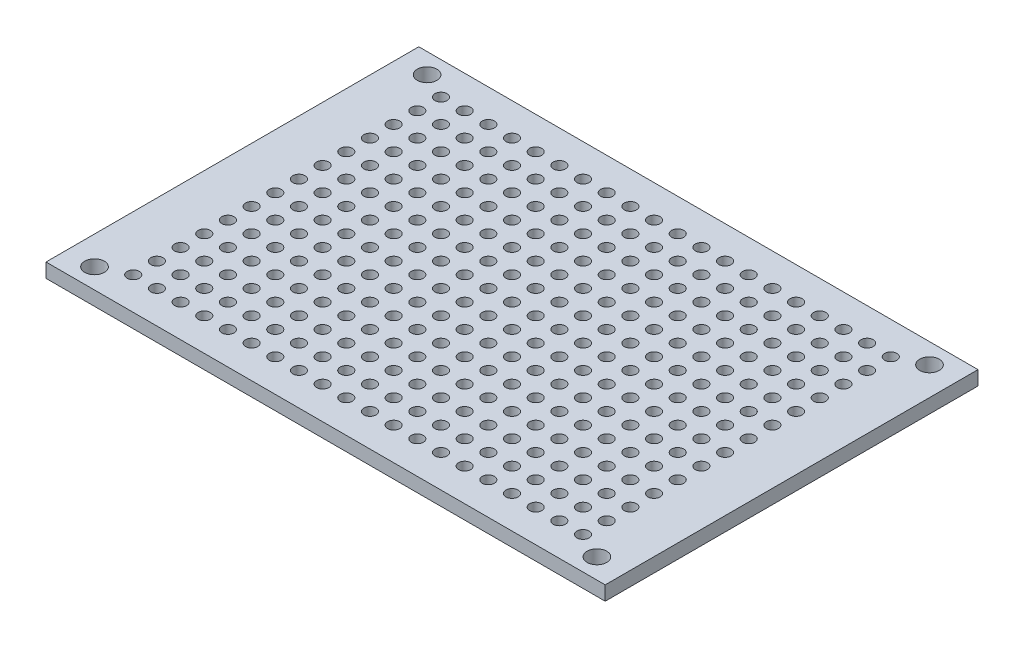
from build123d import *

# Parameters (mm, degrees)
SKETCH1_W                          = 60
SKETCH1_H                          = 40
BOSS_EXTRUDE1_DEPTH                = 0.762
F_1_3_START                        = -0.762
F_1_3_1_3_DIAMETER_HOLE1_OUTLINE_R = 0.65
F_1_3_1_3_DIAMETER_HOLE1_DEPTH     = 1.524
F_2_1_2_1_DIAMETER_HOLE1_D         = 2.1


# Read off the part's stored shape, not the designer's step: Ø1.3 (1.3) Diameter Hole1
with BuildPart() as part:
    # Sketch1 → Boss-Extrude1 (new, symmetric)
    with BuildSketch(Plane(origin=(0, 0, 0), x_dir=(1, 0, 0), z_dir=(0, 1, 0))):
        with Locations((30, 20)):
            Rectangle(SKETCH1_W, SKETCH1_H)
    extrude(amount=BOSS_EXTRUDE1_DEPTH, both=True)

    # Ø1.3 (1.3) Diameter Hole1 outline → Ø1.3 (1.3) Diameter Hole1 (cut)
    with BuildSketch(Plane(origin=(0, 0, 0), x_dir=(1, 0, 0), z_dir=(0, 1, 0)).offset(F_1_3_START)):
        with Locations((5.87, 36.51)):
            Circle(F_1_3_1_3_DIAMETER_HOLE1_OUTLINE_R)
        with Locations((5.87, 33.97)):
            Circle(F_1_3_1_3_DIAMETER_HOLE1_OUTLINE_R)
        with Locations((5.87, 31.43)):
            Circle(F_1_3_1_3_DIAMETER_HOLE1_OUTLINE_R)
        with Locations((5.87, 28.89)):
            Circle(F_1_3_1_3_DIAMETER_HOLE1_OUTLINE_R)
        with Locations((5.87, 26.35)):
            Circle(F_1_3_1_3_DIAMETER_HOLE1_OUTLINE_R)
        with Locations((5.87, 23.81)):
            Circle(F_1_3_1_3_DIAMETER_HOLE1_OUTLINE_R)
        with Locations((5.87, 21.27)):
            Circle(F_1_3_1_3_DIAMETER_HOLE1_OUTLINE_R)
        with Locations((5.87, 18.73)):
            Circle(F_1_3_1_3_DIAMETER_HOLE1_OUTLINE_R)
        with Locations((5.87, 16.19)):
            Circle(F_1_3_1_3_DIAMETER_HOLE1_OUTLINE_R)
        with Locations((5.87, 13.65)):
            Circle(F_1_3_1_3_DIAMETER_HOLE1_OUTLINE_R)
        with Locations((5.87, 11.11)):
            Circle(F_1_3_1_3_DIAMETER_HOLE1_OUTLINE_R)
        with Locations((5.87, 8.57)):
            Circle(F_1_3_1_3_DIAMETER_HOLE1_OUTLINE_R)
        with Locations((5.87, 6.03)):
            Circle(F_1_3_1_3_DIAMETER_HOLE1_OUTLINE_R)
        with Locations((54.13, 36.51)):
            Circle(F_1_3_1_3_DIAMETER_HOLE1_OUTLINE_R)
        with Locations((51.59, 36.51)):
            Circle(F_1_3_1_3_DIAMETER_HOLE1_OUTLINE_R)
        with Locations((49.05, 36.51)):
            Circle(F_1_3_1_3_DIAMETER_HOLE1_OUTLINE_R)
        with Locations((46.51, 36.51)):
            Circle(F_1_3_1_3_DIAMETER_HOLE1_OUTLINE_R)
        with Locations((43.97, 36.51)):
            Circle(F_1_3_1_3_DIAMETER_HOLE1_OUTLINE_R)
        with Locations((41.43, 36.51)):
            Circle(F_1_3_1_3_DIAMETER_HOLE1_OUTLINE_R)
        with Locations((38.89, 36.51)):
            Circle(F_1_3_1_3_DIAMETER_HOLE1_OUTLINE_R)
        with Locations((36.35, 36.51)):
            Circle(F_1_3_1_3_DIAMETER_HOLE1_OUTLINE_R)
        with Locations((33.81, 36.51)):
            Circle(F_1_3_1_3_DIAMETER_HOLE1_OUTLINE_R)
        with Locations((31.27, 36.51)):
            Circle(F_1_3_1_3_DIAMETER_HOLE1_OUTLINE_R)
        with Locations((28.73, 36.51)):
            Circle(F_1_3_1_3_DIAMETER_HOLE1_OUTLINE_R)
        with Locations((26.19, 36.51)):
            Circle(F_1_3_1_3_DIAMETER_HOLE1_OUTLINE_R)
        with Locations((23.65, 36.51)):
            Circle(F_1_3_1_3_DIAMETER_HOLE1_OUTLINE_R)
        with Locations((21.11, 36.51)):
            Circle(F_1_3_1_3_DIAMETER_HOLE1_OUTLINE_R)
        with Locations((18.57, 36.51)):
            Circle(F_1_3_1_3_DIAMETER_HOLE1_OUTLINE_R)
        with Locations((16.03, 36.51)):
            Circle(F_1_3_1_3_DIAMETER_HOLE1_OUTLINE_R)
        with Locations((13.49, 36.51)):
            Circle(F_1_3_1_3_DIAMETER_HOLE1_OUTLINE_R)
        with Locations((10.95, 36.51)):
            Circle(F_1_3_1_3_DIAMETER_HOLE1_OUTLINE_R)
        with Locations((8.41, 36.51)):
            Circle(F_1_3_1_3_DIAMETER_HOLE1_OUTLINE_R)
        with Locations((54.13, 33.97)):
            Circle(F_1_3_1_3_DIAMETER_HOLE1_OUTLINE_R)
        with Locations((51.59, 33.97)):
            Circle(F_1_3_1_3_DIAMETER_HOLE1_OUTLINE_R)
        with Locations((49.05, 33.97)):
            Circle(F_1_3_1_3_DIAMETER_HOLE1_OUTLINE_R)
        with Locations((46.51, 33.97)):
            Circle(F_1_3_1_3_DIAMETER_HOLE1_OUTLINE_R)
        with Locations((43.97, 33.97)):
            Circle(F_1_3_1_3_DIAMETER_HOLE1_OUTLINE_R)
        with Locations((41.43, 33.97)):
            Circle(F_1_3_1_3_DIAMETER_HOLE1_OUTLINE_R)
        with Locations((38.89, 33.97)):
            Circle(F_1_3_1_3_DIAMETER_HOLE1_OUTLINE_R)
        with Locations((36.35, 33.97)):
            Circle(F_1_3_1_3_DIAMETER_HOLE1_OUTLINE_R)
        with Locations((33.81, 33.97)):
            Circle(F_1_3_1_3_DIAMETER_HOLE1_OUTLINE_R)
        with Locations((31.27, 33.97)):
            Circle(F_1_3_1_3_DIAMETER_HOLE1_OUTLINE_R)
        with Locations((28.73, 33.97)):
            Circle(F_1_3_1_3_DIAMETER_HOLE1_OUTLINE_R)
        with Locations((26.19, 33.97)):
            Circle(F_1_3_1_3_DIAMETER_HOLE1_OUTLINE_R)
        with Locations((23.65, 33.97)):
            Circle(F_1_3_1_3_DIAMETER_HOLE1_OUTLINE_R)
        with Locations((21.11, 33.97)):
            Circle(F_1_3_1_3_DIAMETER_HOLE1_OUTLINE_R)
        with Locations((18.57, 33.97)):
            Circle(F_1_3_1_3_DIAMETER_HOLE1_OUTLINE_R)
        with Locations((16.03, 33.97)):
            Circle(F_1_3_1_3_DIAMETER_HOLE1_OUTLINE_R)
        with Locations((13.49, 33.97)):
            Circle(F_1_3_1_3_DIAMETER_HOLE1_OUTLINE_R)
        with Locations((10.95, 33.97)):
            Circle(F_1_3_1_3_DIAMETER_HOLE1_OUTLINE_R)
        with Locations((8.41, 33.97)):
            Circle(F_1_3_1_3_DIAMETER_HOLE1_OUTLINE_R)
        with Locations((54.13, 31.43)):
            Circle(F_1_3_1_3_DIAMETER_HOLE1_OUTLINE_R)
        with Locations((51.59, 31.43)):
            Circle(F_1_3_1_3_DIAMETER_HOLE1_OUTLINE_R)
        with Locations((49.05, 31.43)):
            Circle(F_1_3_1_3_DIAMETER_HOLE1_OUTLINE_R)
        with Locations((46.51, 31.43)):
            Circle(F_1_3_1_3_DIAMETER_HOLE1_OUTLINE_R)
        with Locations((43.97, 31.43)):
            Circle(F_1_3_1_3_DIAMETER_HOLE1_OUTLINE_R)
        with Locations((41.43, 31.43)):
            Circle(F_1_3_1_3_DIAMETER_HOLE1_OUTLINE_R)
        with Locations((38.89, 31.43)):
            Circle(F_1_3_1_3_DIAMETER_HOLE1_OUTLINE_R)
        with Locations((36.35, 31.43)):
            Circle(F_1_3_1_3_DIAMETER_HOLE1_OUTLINE_R)
        with Locations((33.81, 31.43)):
            Circle(F_1_3_1_3_DIAMETER_HOLE1_OUTLINE_R)
        with Locations((31.27, 31.43)):
            Circle(F_1_3_1_3_DIAMETER_HOLE1_OUTLINE_R)
        with Locations((28.73, 31.43)):
            Circle(F_1_3_1_3_DIAMETER_HOLE1_OUTLINE_R)
        with Locations((26.19, 31.43)):
            Circle(F_1_3_1_3_DIAMETER_HOLE1_OUTLINE_R)
        with Locations((23.65, 31.43)):
            Circle(F_1_3_1_3_DIAMETER_HOLE1_OUTLINE_R)
        with Locations((21.11, 31.43)):
            Circle(F_1_3_1_3_DIAMETER_HOLE1_OUTLINE_R)
        with Locations((18.57, 31.43)):
            Circle(F_1_3_1_3_DIAMETER_HOLE1_OUTLINE_R)
        with Locations((16.03, 31.43)):
            Circle(F_1_3_1_3_DIAMETER_HOLE1_OUTLINE_R)
        with Locations((13.49, 31.43)):
            Circle(F_1_3_1_3_DIAMETER_HOLE1_OUTLINE_R)
        with Locations((10.95, 31.43)):
            Circle(F_1_3_1_3_DIAMETER_HOLE1_OUTLINE_R)
        with Locations((8.41, 31.43)):
            Circle(F_1_3_1_3_DIAMETER_HOLE1_OUTLINE_R)
        with Locations((54.13, 28.89)):
            Circle(F_1_3_1_3_DIAMETER_HOLE1_OUTLINE_R)
        with Locations((51.59, 28.89)):
            Circle(F_1_3_1_3_DIAMETER_HOLE1_OUTLINE_R)
        with Locations((49.05, 28.89)):
            Circle(F_1_3_1_3_DIAMETER_HOLE1_OUTLINE_R)
        with Locations((46.51, 28.89)):
            Circle(F_1_3_1_3_DIAMETER_HOLE1_OUTLINE_R)
        with Locations((43.97, 28.89)):
            Circle(F_1_3_1_3_DIAMETER_HOLE1_OUTLINE_R)
        with Locations((41.43, 28.89)):
            Circle(F_1_3_1_3_DIAMETER_HOLE1_OUTLINE_R)
        with Locations((38.89, 28.89)):
            Circle(F_1_3_1_3_DIAMETER_HOLE1_OUTLINE_R)
        with Locations((36.35, 28.89)):
            Circle(F_1_3_1_3_DIAMETER_HOLE1_OUTLINE_R)
        with Locations((33.81, 28.89)):
            Circle(F_1_3_1_3_DIAMETER_HOLE1_OUTLINE_R)
        with Locations((31.27, 28.89)):
            Circle(F_1_3_1_3_DIAMETER_HOLE1_OUTLINE_R)
        with Locations((28.73, 28.89)):
            Circle(F_1_3_1_3_DIAMETER_HOLE1_OUTLINE_R)
        with Locations((26.19, 28.89)):
            Circle(F_1_3_1_3_DIAMETER_HOLE1_OUTLINE_R)
        with Locations((23.65, 28.89)):
            Circle(F_1_3_1_3_DIAMETER_HOLE1_OUTLINE_R)
        with Locations((21.11, 28.89)):
            Circle(F_1_3_1_3_DIAMETER_HOLE1_OUTLINE_R)
        with Locations((18.57, 28.89)):
            Circle(F_1_3_1_3_DIAMETER_HOLE1_OUTLINE_R)
        with Locations((16.03, 28.89)):
            Circle(F_1_3_1_3_DIAMETER_HOLE1_OUTLINE_R)
        with Locations((13.49, 28.89)):
            Circle(F_1_3_1_3_DIAMETER_HOLE1_OUTLINE_R)
        with Locations((10.95, 28.89)):
            Circle(F_1_3_1_3_DIAMETER_HOLE1_OUTLINE_R)
        with Locations((8.41, 28.89)):
            Circle(F_1_3_1_3_DIAMETER_HOLE1_OUTLINE_R)
        with Locations((54.13, 26.35)):
            Circle(F_1_3_1_3_DIAMETER_HOLE1_OUTLINE_R)
        with Locations((51.59, 26.35)):
            Circle(F_1_3_1_3_DIAMETER_HOLE1_OUTLINE_R)
        with Locations((49.05, 26.35)):
            Circle(F_1_3_1_3_DIAMETER_HOLE1_OUTLINE_R)
        with Locations((46.51, 26.35)):
            Circle(F_1_3_1_3_DIAMETER_HOLE1_OUTLINE_R)
        with Locations((43.97, 26.35)):
            Circle(F_1_3_1_3_DIAMETER_HOLE1_OUTLINE_R)
        with Locations((41.43, 26.35)):
            Circle(F_1_3_1_3_DIAMETER_HOLE1_OUTLINE_R)
        with Locations((38.89, 26.35)):
            Circle(F_1_3_1_3_DIAMETER_HOLE1_OUTLINE_R)
        with Locations((36.35, 26.35)):
            Circle(F_1_3_1_3_DIAMETER_HOLE1_OUTLINE_R)
        with Locations((33.81, 26.35)):
            Circle(F_1_3_1_3_DIAMETER_HOLE1_OUTLINE_R)
        with Locations((31.27, 26.35)):
            Circle(F_1_3_1_3_DIAMETER_HOLE1_OUTLINE_R)
        with Locations((28.73, 26.35)):
            Circle(F_1_3_1_3_DIAMETER_HOLE1_OUTLINE_R)
        with Locations((26.19, 26.35)):
            Circle(F_1_3_1_3_DIAMETER_HOLE1_OUTLINE_R)
        with Locations((23.65, 26.35)):
            Circle(F_1_3_1_3_DIAMETER_HOLE1_OUTLINE_R)
        with Locations((21.11, 26.35)):
            Circle(F_1_3_1_3_DIAMETER_HOLE1_OUTLINE_R)
        with Locations((18.57, 26.35)):
            Circle(F_1_3_1_3_DIAMETER_HOLE1_OUTLINE_R)
        with Locations((16.03, 26.35)):
            Circle(F_1_3_1_3_DIAMETER_HOLE1_OUTLINE_R)
        with Locations((13.49, 26.35)):
            Circle(F_1_3_1_3_DIAMETER_HOLE1_OUTLINE_R)
        with Locations((10.95, 26.35)):
            Circle(F_1_3_1_3_DIAMETER_HOLE1_OUTLINE_R)
        with Locations((8.41, 26.35)):
            Circle(F_1_3_1_3_DIAMETER_HOLE1_OUTLINE_R)
        with Locations((54.13, 23.81)):
            Circle(F_1_3_1_3_DIAMETER_HOLE1_OUTLINE_R)
        with Locations((51.59, 23.81)):
            Circle(F_1_3_1_3_DIAMETER_HOLE1_OUTLINE_R)
        with Locations((49.05, 23.81)):
            Circle(F_1_3_1_3_DIAMETER_HOLE1_OUTLINE_R)
        with Locations((46.51, 23.81)):
            Circle(F_1_3_1_3_DIAMETER_HOLE1_OUTLINE_R)
        with Locations((43.97, 23.81)):
            Circle(F_1_3_1_3_DIAMETER_HOLE1_OUTLINE_R)
        with Locations((41.43, 23.81)):
            Circle(F_1_3_1_3_DIAMETER_HOLE1_OUTLINE_R)
        with Locations((38.89, 23.81)):
            Circle(F_1_3_1_3_DIAMETER_HOLE1_OUTLINE_R)
        with Locations((36.35, 23.81)):
            Circle(F_1_3_1_3_DIAMETER_HOLE1_OUTLINE_R)
        with Locations((33.81, 23.81)):
            Circle(F_1_3_1_3_DIAMETER_HOLE1_OUTLINE_R)
        with Locations((31.27, 23.81)):
            Circle(F_1_3_1_3_DIAMETER_HOLE1_OUTLINE_R)
        with Locations((28.73, 23.81)):
            Circle(F_1_3_1_3_DIAMETER_HOLE1_OUTLINE_R)
        with Locations((26.19, 23.81)):
            Circle(F_1_3_1_3_DIAMETER_HOLE1_OUTLINE_R)
        with Locations((23.65, 23.81)):
            Circle(F_1_3_1_3_DIAMETER_HOLE1_OUTLINE_R)
        with Locations((21.11, 23.81)):
            Circle(F_1_3_1_3_DIAMETER_HOLE1_OUTLINE_R)
        with Locations((18.57, 23.81)):
            Circle(F_1_3_1_3_DIAMETER_HOLE1_OUTLINE_R)
        with Locations((16.03, 23.81)):
            Circle(F_1_3_1_3_DIAMETER_HOLE1_OUTLINE_R)
        with Locations((13.49, 23.81)):
            Circle(F_1_3_1_3_DIAMETER_HOLE1_OUTLINE_R)
        with Locations((10.95, 23.81)):
            Circle(F_1_3_1_3_DIAMETER_HOLE1_OUTLINE_R)
        with Locations((8.41, 23.81)):
            Circle(F_1_3_1_3_DIAMETER_HOLE1_OUTLINE_R)
        with Locations((54.13, 21.27)):
            Circle(F_1_3_1_3_DIAMETER_HOLE1_OUTLINE_R)
        with Locations((51.59, 21.27)):
            Circle(F_1_3_1_3_DIAMETER_HOLE1_OUTLINE_R)
        with Locations((49.05, 21.27)):
            Circle(F_1_3_1_3_DIAMETER_HOLE1_OUTLINE_R)
        with Locations((46.51, 21.27)):
            Circle(F_1_3_1_3_DIAMETER_HOLE1_OUTLINE_R)
        with Locations((43.97, 21.27)):
            Circle(F_1_3_1_3_DIAMETER_HOLE1_OUTLINE_R)
        with Locations((41.43, 21.27)):
            Circle(F_1_3_1_3_DIAMETER_HOLE1_OUTLINE_R)
        with Locations((38.89, 21.27)):
            Circle(F_1_3_1_3_DIAMETER_HOLE1_OUTLINE_R)
        with Locations((36.35, 21.27)):
            Circle(F_1_3_1_3_DIAMETER_HOLE1_OUTLINE_R)
        with Locations((33.81, 21.27)):
            Circle(F_1_3_1_3_DIAMETER_HOLE1_OUTLINE_R)
        with Locations((31.27, 21.27)):
            Circle(F_1_3_1_3_DIAMETER_HOLE1_OUTLINE_R)
        with Locations((28.73, 21.27)):
            Circle(F_1_3_1_3_DIAMETER_HOLE1_OUTLINE_R)
        with Locations((26.19, 21.27)):
            Circle(F_1_3_1_3_DIAMETER_HOLE1_OUTLINE_R)
        with Locations((23.65, 21.27)):
            Circle(F_1_3_1_3_DIAMETER_HOLE1_OUTLINE_R)
        with Locations((21.11, 21.27)):
            Circle(F_1_3_1_3_DIAMETER_HOLE1_OUTLINE_R)
        with Locations((18.57, 21.27)):
            Circle(F_1_3_1_3_DIAMETER_HOLE1_OUTLINE_R)
        with Locations((16.03, 21.27)):
            Circle(F_1_3_1_3_DIAMETER_HOLE1_OUTLINE_R)
        with Locations((13.49, 21.27)):
            Circle(F_1_3_1_3_DIAMETER_HOLE1_OUTLINE_R)
        with Locations((10.95, 21.27)):
            Circle(F_1_3_1_3_DIAMETER_HOLE1_OUTLINE_R)
        with Locations((8.41, 21.27)):
            Circle(F_1_3_1_3_DIAMETER_HOLE1_OUTLINE_R)
        with Locations((54.13, 18.73)):
            Circle(F_1_3_1_3_DIAMETER_HOLE1_OUTLINE_R)
        with Locations((51.59, 18.73)):
            Circle(F_1_3_1_3_DIAMETER_HOLE1_OUTLINE_R)
        with Locations((49.05, 18.73)):
            Circle(F_1_3_1_3_DIAMETER_HOLE1_OUTLINE_R)
        with Locations((46.51, 18.73)):
            Circle(F_1_3_1_3_DIAMETER_HOLE1_OUTLINE_R)
        with Locations((43.97, 18.73)):
            Circle(F_1_3_1_3_DIAMETER_HOLE1_OUTLINE_R)
        with Locations((41.43, 18.73)):
            Circle(F_1_3_1_3_DIAMETER_HOLE1_OUTLINE_R)
        with Locations((38.89, 18.73)):
            Circle(F_1_3_1_3_DIAMETER_HOLE1_OUTLINE_R)
        with Locations((36.35, 18.73)):
            Circle(F_1_3_1_3_DIAMETER_HOLE1_OUTLINE_R)
        with Locations((33.81, 18.73)):
            Circle(F_1_3_1_3_DIAMETER_HOLE1_OUTLINE_R)
        with Locations((31.27, 18.73)):
            Circle(F_1_3_1_3_DIAMETER_HOLE1_OUTLINE_R)
        with Locations((28.73, 18.73)):
            Circle(F_1_3_1_3_DIAMETER_HOLE1_OUTLINE_R)
        with Locations((26.19, 18.73)):
            Circle(F_1_3_1_3_DIAMETER_HOLE1_OUTLINE_R)
        with Locations((23.65, 18.73)):
            Circle(F_1_3_1_3_DIAMETER_HOLE1_OUTLINE_R)
        with Locations((21.11, 18.73)):
            Circle(F_1_3_1_3_DIAMETER_HOLE1_OUTLINE_R)
        with Locations((18.57, 18.73)):
            Circle(F_1_3_1_3_DIAMETER_HOLE1_OUTLINE_R)
        with Locations((16.03, 18.73)):
            Circle(F_1_3_1_3_DIAMETER_HOLE1_OUTLINE_R)
        with Locations((13.49, 18.73)):
            Circle(F_1_3_1_3_DIAMETER_HOLE1_OUTLINE_R)
        with Locations((10.95, 18.73)):
            Circle(F_1_3_1_3_DIAMETER_HOLE1_OUTLINE_R)
        with Locations((8.41, 18.73)):
            Circle(F_1_3_1_3_DIAMETER_HOLE1_OUTLINE_R)
        with Locations((54.13, 16.19)):
            Circle(F_1_3_1_3_DIAMETER_HOLE1_OUTLINE_R)
        with Locations((51.59, 16.19)):
            Circle(F_1_3_1_3_DIAMETER_HOLE1_OUTLINE_R)
        with Locations((49.05, 16.19)):
            Circle(F_1_3_1_3_DIAMETER_HOLE1_OUTLINE_R)
        with Locations((46.51, 16.19)):
            Circle(F_1_3_1_3_DIAMETER_HOLE1_OUTLINE_R)
        with Locations((43.97, 16.19)):
            Circle(F_1_3_1_3_DIAMETER_HOLE1_OUTLINE_R)
        with Locations((41.43, 16.19)):
            Circle(F_1_3_1_3_DIAMETER_HOLE1_OUTLINE_R)
        with Locations((38.89, 16.19)):
            Circle(F_1_3_1_3_DIAMETER_HOLE1_OUTLINE_R)
        with Locations((36.35, 16.19)):
            Circle(F_1_3_1_3_DIAMETER_HOLE1_OUTLINE_R)
        with Locations((33.81, 16.19)):
            Circle(F_1_3_1_3_DIAMETER_HOLE1_OUTLINE_R)
        with Locations((31.27, 16.19)):
            Circle(F_1_3_1_3_DIAMETER_HOLE1_OUTLINE_R)
        with Locations((28.73, 16.19)):
            Circle(F_1_3_1_3_DIAMETER_HOLE1_OUTLINE_R)
        with Locations((26.19, 16.19)):
            Circle(F_1_3_1_3_DIAMETER_HOLE1_OUTLINE_R)
        with Locations((23.65, 16.19)):
            Circle(F_1_3_1_3_DIAMETER_HOLE1_OUTLINE_R)
        with Locations((21.11, 16.19)):
            Circle(F_1_3_1_3_DIAMETER_HOLE1_OUTLINE_R)
        with Locations((18.57, 16.19)):
            Circle(F_1_3_1_3_DIAMETER_HOLE1_OUTLINE_R)
        with Locations((16.03, 16.19)):
            Circle(F_1_3_1_3_DIAMETER_HOLE1_OUTLINE_R)
        with Locations((13.49, 16.19)):
            Circle(F_1_3_1_3_DIAMETER_HOLE1_OUTLINE_R)
        with Locations((10.95, 16.19)):
            Circle(F_1_3_1_3_DIAMETER_HOLE1_OUTLINE_R)
        with Locations((8.41, 16.19)):
            Circle(F_1_3_1_3_DIAMETER_HOLE1_OUTLINE_R)
        with Locations((54.13, 13.65)):
            Circle(F_1_3_1_3_DIAMETER_HOLE1_OUTLINE_R)
        with Locations((51.59, 13.65)):
            Circle(F_1_3_1_3_DIAMETER_HOLE1_OUTLINE_R)
        with Locations((49.05, 13.65)):
            Circle(F_1_3_1_3_DIAMETER_HOLE1_OUTLINE_R)
        with Locations((46.51, 13.65)):
            Circle(F_1_3_1_3_DIAMETER_HOLE1_OUTLINE_R)
        with Locations((43.97, 13.65)):
            Circle(F_1_3_1_3_DIAMETER_HOLE1_OUTLINE_R)
        with Locations((41.43, 13.65)):
            Circle(F_1_3_1_3_DIAMETER_HOLE1_OUTLINE_R)
        with Locations((38.89, 13.65)):
            Circle(F_1_3_1_3_DIAMETER_HOLE1_OUTLINE_R)
        with Locations((36.35, 13.65)):
            Circle(F_1_3_1_3_DIAMETER_HOLE1_OUTLINE_R)
        with Locations((33.81, 13.65)):
            Circle(F_1_3_1_3_DIAMETER_HOLE1_OUTLINE_R)
        with Locations((31.27, 13.65)):
            Circle(F_1_3_1_3_DIAMETER_HOLE1_OUTLINE_R)
        with Locations((28.73, 13.65)):
            Circle(F_1_3_1_3_DIAMETER_HOLE1_OUTLINE_R)
        with Locations((26.19, 13.65)):
            Circle(F_1_3_1_3_DIAMETER_HOLE1_OUTLINE_R)
        with Locations((23.65, 13.65)):
            Circle(F_1_3_1_3_DIAMETER_HOLE1_OUTLINE_R)
        with Locations((21.11, 13.65)):
            Circle(F_1_3_1_3_DIAMETER_HOLE1_OUTLINE_R)
        with Locations((18.57, 13.65)):
            Circle(F_1_3_1_3_DIAMETER_HOLE1_OUTLINE_R)
        with Locations((16.03, 13.65)):
            Circle(F_1_3_1_3_DIAMETER_HOLE1_OUTLINE_R)
        with Locations((13.49, 13.65)):
            Circle(F_1_3_1_3_DIAMETER_HOLE1_OUTLINE_R)
        with Locations((10.95, 13.65)):
            Circle(F_1_3_1_3_DIAMETER_HOLE1_OUTLINE_R)
        with Locations((8.41, 13.65)):
            Circle(F_1_3_1_3_DIAMETER_HOLE1_OUTLINE_R)
        with Locations((54.13, 11.11)):
            Circle(F_1_3_1_3_DIAMETER_HOLE1_OUTLINE_R)
        with Locations((51.59, 11.11)):
            Circle(F_1_3_1_3_DIAMETER_HOLE1_OUTLINE_R)
        with Locations((49.05, 11.11)):
            Circle(F_1_3_1_3_DIAMETER_HOLE1_OUTLINE_R)
        with Locations((46.51, 11.11)):
            Circle(F_1_3_1_3_DIAMETER_HOLE1_OUTLINE_R)
        with Locations((43.97, 11.11)):
            Circle(F_1_3_1_3_DIAMETER_HOLE1_OUTLINE_R)
        with Locations((41.43, 11.11)):
            Circle(F_1_3_1_3_DIAMETER_HOLE1_OUTLINE_R)
        with Locations((38.89, 11.11)):
            Circle(F_1_3_1_3_DIAMETER_HOLE1_OUTLINE_R)
        with Locations((36.35, 11.11)):
            Circle(F_1_3_1_3_DIAMETER_HOLE1_OUTLINE_R)
        with Locations((33.81, 11.11)):
            Circle(F_1_3_1_3_DIAMETER_HOLE1_OUTLINE_R)
        with Locations((31.27, 11.11)):
            Circle(F_1_3_1_3_DIAMETER_HOLE1_OUTLINE_R)
        with Locations((28.73, 11.11)):
            Circle(F_1_3_1_3_DIAMETER_HOLE1_OUTLINE_R)
        with Locations((26.19, 11.11)):
            Circle(F_1_3_1_3_DIAMETER_HOLE1_OUTLINE_R)
        with Locations((23.65, 11.11)):
            Circle(F_1_3_1_3_DIAMETER_HOLE1_OUTLINE_R)
        with Locations((21.11, 11.11)):
            Circle(F_1_3_1_3_DIAMETER_HOLE1_OUTLINE_R)
        with Locations((18.57, 11.11)):
            Circle(F_1_3_1_3_DIAMETER_HOLE1_OUTLINE_R)
        with Locations((16.03, 11.11)):
            Circle(F_1_3_1_3_DIAMETER_HOLE1_OUTLINE_R)
        with Locations((13.49, 11.11)):
            Circle(F_1_3_1_3_DIAMETER_HOLE1_OUTLINE_R)
        with Locations((10.95, 11.11)):
            Circle(F_1_3_1_3_DIAMETER_HOLE1_OUTLINE_R)
        with Locations((8.41, 11.11)):
            Circle(F_1_3_1_3_DIAMETER_HOLE1_OUTLINE_R)
        with Locations((54.13, 8.57)):
            Circle(F_1_3_1_3_DIAMETER_HOLE1_OUTLINE_R)
        with Locations((51.59, 8.57)):
            Circle(F_1_3_1_3_DIAMETER_HOLE1_OUTLINE_R)
        with Locations((49.05, 8.57)):
            Circle(F_1_3_1_3_DIAMETER_HOLE1_OUTLINE_R)
        with Locations((46.51, 8.57)):
            Circle(F_1_3_1_3_DIAMETER_HOLE1_OUTLINE_R)
        with Locations((43.97, 8.57)):
            Circle(F_1_3_1_3_DIAMETER_HOLE1_OUTLINE_R)
        with Locations((41.43, 8.57)):
            Circle(F_1_3_1_3_DIAMETER_HOLE1_OUTLINE_R)
        with Locations((38.89, 8.57)):
            Circle(F_1_3_1_3_DIAMETER_HOLE1_OUTLINE_R)
        with Locations((36.35, 8.57)):
            Circle(F_1_3_1_3_DIAMETER_HOLE1_OUTLINE_R)
        with Locations((33.81, 8.57)):
            Circle(F_1_3_1_3_DIAMETER_HOLE1_OUTLINE_R)
        with Locations((31.27, 8.57)):
            Circle(F_1_3_1_3_DIAMETER_HOLE1_OUTLINE_R)
        with Locations((28.73, 8.57)):
            Circle(F_1_3_1_3_DIAMETER_HOLE1_OUTLINE_R)
        with Locations((26.19, 8.57)):
            Circle(F_1_3_1_3_DIAMETER_HOLE1_OUTLINE_R)
        with Locations((23.65, 8.57)):
            Circle(F_1_3_1_3_DIAMETER_HOLE1_OUTLINE_R)
        with Locations((21.11, 8.57)):
            Circle(F_1_3_1_3_DIAMETER_HOLE1_OUTLINE_R)
        with Locations((18.57, 8.57)):
            Circle(F_1_3_1_3_DIAMETER_HOLE1_OUTLINE_R)
        with Locations((16.03, 8.57)):
            Circle(F_1_3_1_3_DIAMETER_HOLE1_OUTLINE_R)
        with Locations((13.49, 8.57)):
            Circle(F_1_3_1_3_DIAMETER_HOLE1_OUTLINE_R)
        with Locations((10.95, 8.57)):
            Circle(F_1_3_1_3_DIAMETER_HOLE1_OUTLINE_R)
        with Locations((8.41, 8.57)):
            Circle(F_1_3_1_3_DIAMETER_HOLE1_OUTLINE_R)
        with Locations((54.13, 6.03)):
            Circle(F_1_3_1_3_DIAMETER_HOLE1_OUTLINE_R)
        with Locations((51.59, 6.03)):
            Circle(F_1_3_1_3_DIAMETER_HOLE1_OUTLINE_R)
        with Locations((49.05, 6.03)):
            Circle(F_1_3_1_3_DIAMETER_HOLE1_OUTLINE_R)
        with Locations((46.51, 6.03)):
            Circle(F_1_3_1_3_DIAMETER_HOLE1_OUTLINE_R)
        with Locations((43.97, 6.03)):
            Circle(F_1_3_1_3_DIAMETER_HOLE1_OUTLINE_R)
        with Locations((41.43, 6.03)):
            Circle(F_1_3_1_3_DIAMETER_HOLE1_OUTLINE_R)
        with Locations((38.89, 6.03)):
            Circle(F_1_3_1_3_DIAMETER_HOLE1_OUTLINE_R)
        with Locations((36.35, 6.03)):
            Circle(F_1_3_1_3_DIAMETER_HOLE1_OUTLINE_R)
        with Locations((33.81, 6.03)):
            Circle(F_1_3_1_3_DIAMETER_HOLE1_OUTLINE_R)
        with Locations((31.27, 6.03)):
            Circle(F_1_3_1_3_DIAMETER_HOLE1_OUTLINE_R)
        with Locations((28.73, 6.03)):
            Circle(F_1_3_1_3_DIAMETER_HOLE1_OUTLINE_R)
        with Locations((26.19, 6.03)):
            Circle(F_1_3_1_3_DIAMETER_HOLE1_OUTLINE_R)
        with Locations((23.65, 6.03)):
            Circle(F_1_3_1_3_DIAMETER_HOLE1_OUTLINE_R)
        with Locations((21.11, 6.03)):
            Circle(F_1_3_1_3_DIAMETER_HOLE1_OUTLINE_R)
        with Locations((18.57, 6.03)):
            Circle(F_1_3_1_3_DIAMETER_HOLE1_OUTLINE_R)
        with Locations((16.03, 6.03)):
            Circle(F_1_3_1_3_DIAMETER_HOLE1_OUTLINE_R)
        with Locations((13.49, 6.03)):
            Circle(F_1_3_1_3_DIAMETER_HOLE1_OUTLINE_R)
        with Locations((10.95, 6.03)):
            Circle(F_1_3_1_3_DIAMETER_HOLE1_OUTLINE_R)
        with Locations((8.41, 6.03)):
            Circle(F_1_3_1_3_DIAMETER_HOLE1_OUTLINE_R)
        with Locations((54.13, 3.49)):
            Circle(F_1_3_1_3_DIAMETER_HOLE1_OUTLINE_R)
        with Locations((51.59, 3.49)):
            Circle(F_1_3_1_3_DIAMETER_HOLE1_OUTLINE_R)
        with Locations((49.05, 3.49)):
            Circle(F_1_3_1_3_DIAMETER_HOLE1_OUTLINE_R)
        with Locations((46.51, 3.49)):
            Circle(F_1_3_1_3_DIAMETER_HOLE1_OUTLINE_R)
        with Locations((43.97, 3.49)):
            Circle(F_1_3_1_3_DIAMETER_HOLE1_OUTLINE_R)
        with Locations((41.43, 3.49)):
            Circle(F_1_3_1_3_DIAMETER_HOLE1_OUTLINE_R)
        with Locations((38.89, 3.49)):
            Circle(F_1_3_1_3_DIAMETER_HOLE1_OUTLINE_R)
        with Locations((36.35, 3.49)):
            Circle(F_1_3_1_3_DIAMETER_HOLE1_OUTLINE_R)
        with Locations((33.81, 3.49)):
            Circle(F_1_3_1_3_DIAMETER_HOLE1_OUTLINE_R)
        with Locations((31.27, 3.49)):
            Circle(F_1_3_1_3_DIAMETER_HOLE1_OUTLINE_R)
        with Locations((28.73, 3.49)):
            Circle(F_1_3_1_3_DIAMETER_HOLE1_OUTLINE_R)
        with Locations((26.19, 3.49)):
            Circle(F_1_3_1_3_DIAMETER_HOLE1_OUTLINE_R)
        with Locations((23.65, 3.49)):
            Circle(F_1_3_1_3_DIAMETER_HOLE1_OUTLINE_R)
        with Locations((21.11, 3.49)):
            Circle(F_1_3_1_3_DIAMETER_HOLE1_OUTLINE_R)
        with Locations((18.57, 3.49)):
            Circle(F_1_3_1_3_DIAMETER_HOLE1_OUTLINE_R)
        with Locations((16.03, 3.49)):
            Circle(F_1_3_1_3_DIAMETER_HOLE1_OUTLINE_R)
        with Locations((13.49, 3.49)):
            Circle(F_1_3_1_3_DIAMETER_HOLE1_OUTLINE_R)
        with Locations((10.95, 3.49)):
            Circle(F_1_3_1_3_DIAMETER_HOLE1_OUTLINE_R)
        with Locations((8.41, 3.49)):
            Circle(F_1_3_1_3_DIAMETER_HOLE1_OUTLINE_R)
        with Locations((5.87, 3.49)):
            Circle(F_1_3_1_3_DIAMETER_HOLE1_OUTLINE_R)
    extrude(amount=F_1_3_1_3_DIAMETER_HOLE1_DEPTH, mode=Mode.SUBTRACT)

    # Ø2.1 (2.1) Diameter Hole1 (through all)
    with Locations(Plane(origin=(0, 0.762, 0), x_dir=(1, 0, 0), z_dir=(0, 1, 0))):
        with Locations((3.048, 37.841), (56.952, 2.159), (56.952, 37.841), (3.048, 2.159)):
            Hole(F_2_1_2_1_DIAMETER_HOLE1_D / 2)


solid = part.part
